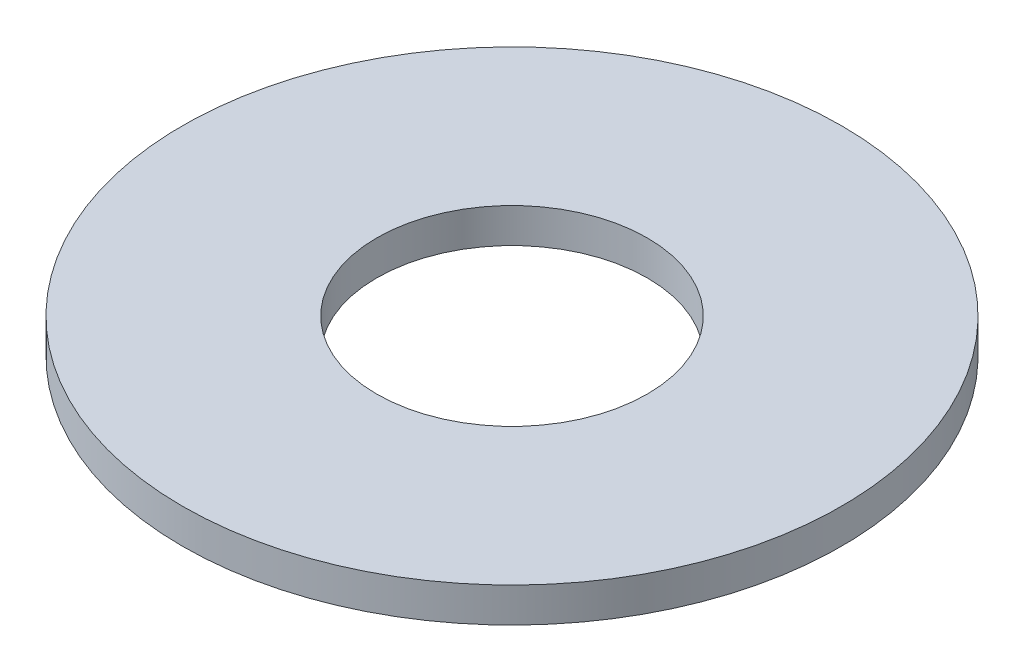
from build123d import *

# Parameters (mm, degrees)
SKETCH1_R           = 38
SKETCH1_R_2         = 15.6
BOSS_EXTRUDE1_DEPTH = 4


with BuildPart() as part:
    # Sketch1 → Boss-Extrude1 (new body)
    with BuildSketch(Plane(origin=(0, 0, 0), x_dir=(1, 0, 0), z_dir=(0, 1, 0))):
        Circle(SKETCH1_R)
        Circle(SKETCH1_R_2, mode=Mode.SUBTRACT)
    extrude(amount=BOSS_EXTRUDE1_DEPTH)


solid = part.part
